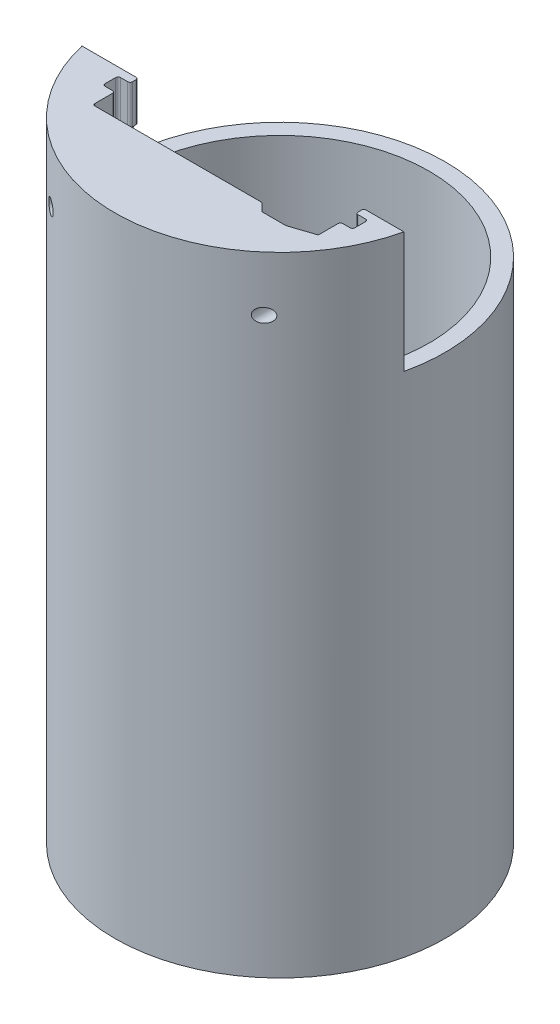
from build123d import *

# Parameters (mm, degrees)
SKETCH1_R                    = 20.5
SKETCH1_R_2                  = 7.5
BOSS_EXTRUDE1_DEPTH          = 3
SKETCH3_R                    = 1.4
CUT_EXTRUDE1_DEPTH           = 5
CHAMFER6_SIZE                = 0.3
CIRPATTERN2_COUNT            = 4
CHAMFER6_OF_CIRPATTERN2_SIZE = 0.3
SKETCH4_R                    = 20.5
SKETCH4_R_2                  = 1.4
SKETCH4_W                    = 1.5
SKETCH4_H                    = 1
BOSS_EXTRUDE2_DEPTH          = 60
SKETCH6_W                    = 1.5
SKETCH6_H                    = 1
BOSS_EXTRUDE4_DEPTH          = 15
FILLET1_R                    = 0.3
SKETCH7_R                    = 2.5
CUT_EXTRUDE2_DEPTH           = 1.5
SKETCH8_R                    = 0.85
CUT_EXTRUDE3_DEPTH           = 86.371248179
CHAMFER2_SIZE                = 0.2
CHAMFER4_SIZE                = 1
CHAMFER5_R                   = 0.2
SKETCH9_R                    = 1.4
CUT_EXTRUDE4_DEPTH           = 5


with BuildPart() as part:
    # Sketch1 → Boss-Extrude1 (new body)
    with BuildSketch(Plane(origin=(0, 0, 0), x_dir=(1, 0, 0), z_dir=(0, 1, 0))):
        with Locations(Location((0, 0, 0), (0, 0, 270))):
            Circle(SKETCH1_R)
        with Locations(Location((0, 0, 0), (0, 0, 270))):
            Circle(SKETCH1_R_2, mode=Mode.SUBTRACT)
    extrude(amount=BOSS_EXTRUDE1_DEPTH)

    # Sketch3 → Cut-Extrude1 (cut)
    with BuildSketch(Plane.XZ):
        with Locations(Location((0, 14.35, 0), (0, 0, 270))):
            Circle(SKETCH3_R)
    cut_extrude1 = extrude(amount=-CUT_EXTRUDE1_DEPTH, mode=Mode.SUBTRACT)

    # Chamfer6
    chamfer6_edges = [part.edges().sort_by_distance(p)[0] for p in [
        (0, 0, 15.75),
    ]]
    chamfer(chamfer6_edges, length=CHAMFER6_SIZE)

    # CirPattern2: Cut-Extrude1 ×4 about axis
    cirpattern2_axis = Axis((0, 0, 0), (0, 1, 0))
    for i in range(1, CIRPATTERN2_COUNT):
        add(cut_extrude1.rotate(cirpattern2_axis, i * 360 / CIRPATTERN2_COUNT), mode=Mode.SUBTRACT)

    # Chamfer6 of CirPattern2
    chamfer6_of_cirpattern2_edges = [part.edges().sort_by_distance(p)[0] for p in [
        (15.75, 0, 0),
        (0, 0, -15.75),
        (-15.75, 0, 0),
    ]]
    chamfer(chamfer6_of_cirpattern2_edges, length=CHAMFER6_OF_CIRPATTERN2_SIZE)

    # Sketch4 → Boss-Extrude2 (add)
    # profile 1 of 8: a face of its own
    with BuildSketch(Plane(origin=(0, 3, 0), x_dir=(1, 0, 0), z_dir=(0, 1, 0))):
        with Locations(Location((0, 0, 0), (0, 0, 270))):
            Circle(SKETCH4_R)
        with BuildLine():
            ThreePointArc((14.686303143, -11.25), (-3.697050438, -18.126825923), (-17.918984346, -4.6))
            ThreePointArc((-17.918984346, -4.6), (-2.318274099, 18.35417133), (18.5, 0))
            ThreePointArc((18.5, 0), (18.35417133, -2.318274099), (17.918984346, -4.6))
            ThreePointArc((17.918984346, -4.6), (16.751492877, -7.85095449), (15, -10.828203914))
            Line((15, -10.828203914), (15, -11.25))
            Line((15, -11.25), (14.686303143, -11.25))
        make_face(mode=Mode.SUBTRACT)
    # profile 2 of 8: a face of its own
    with BuildSketch(Plane(origin=(0, 3, 0), x_dir=(1, 0, 0), z_dir=(0, 1, 0))):
        with BuildLine():
            Line((-14.5, -7.5), (-14.5, -5.6))
            Line((-14.5, -5.6), (-14.5, -4.6))
            Line((-14.5, -4.6), (-17.918984346, -4.6))
            ThreePointArc((-17.918984346, -4.6), (-3.697050438, -18.126825923), (14.686303143, -11.25))
            Line((14.686303143, -11.25), (12, -11.25))
            Line((12, -11.25), (9, -11.25))
            Line((9, -11.25), (9, -10.25))
            Line((9, -10.25), (-13, -10.25))
            Line((-13, -10.25), (-13, -7.5))
            Line((-13, -7.5), (-14.5, -7.5))
        make_face()
        with Locations(Location((0, -14.35, 0), (0, 0, 270))):
            Circle(SKETCH4_R_2, mode=Mode.SUBTRACT)
    # profile 3 of 8: a face of its own
    with BuildSketch(Plane(origin=(0, 3, 0), x_dir=(1, 0, 0), z_dir=(0, 1, 0))):
        with BuildLine():
            Line((16.5, -4.6), (16.5, -5.6))
            Line((16.5, -5.6), (16.5, -7.5))
            Line((16.5, -7.5), (15, -7.5))
            Line((15, -7.5), (15, -10.25))
            Line((15, -10.25), (15, -10.828203914))
            ThreePointArc((15, -10.828203914), (16.751492877, -7.85095449), (17.918984346, -4.6))
            Line((17.918984346, -4.6), (16.5, -4.6))
        make_face()
    # profile 4 of 8: a face of its own
    with BuildSketch(Plane(origin=(0, 3, 0), x_dir=(1, 0, 0), z_dir=(0, 1, 0))):
        with BuildLine():
            Line((12, -11.25), (14.686303143, -11.25))
            ThreePointArc((14.686303143, -11.25), (14.844649762, -11.040216187), (15, -10.828203914))
            Line((15, -10.828203914), (15, -10.25))
            Line((15, -10.25), (12, -11.25))
        make_face()
    # profile 5 of 8: a face of its own
    with BuildSketch(Plane(origin=(0, 3, 0), x_dir=(1, 0, 0), z_dir=(0, 1, 0))):
        with Locations((15.75, -5.1)):
            Rectangle(SKETCH4_W, SKETCH4_H)
    # profile 6 of 8: a face of its own
    with BuildSketch(Plane(origin=(0, 3, 0), x_dir=(1, 0, 0), z_dir=(0, 1, 0))):
        with Locations((-13.75, -5.1)):
            Rectangle(SKETCH4_W, SKETCH4_H)
    # profile 7 of 8: a face of its own
    with BuildSketch(Plane(origin=(0, 3, 0), x_dir=(1, 0, 0), z_dir=(0, 1, 0))):
        with Locations(Location((0, -14.35, 0), (0, 0, 270))):
            Circle(SKETCH4_R_2)
    # profile 8 of 8: a face of its own
    with BuildSketch(Plane(origin=(0, 3, 0), x_dir=(1, 0, 0), z_dir=(0, 1, 0))):
        with BuildLine():
            ThreePointArc((15, -10.828203914), (14.844649762, -11.040216187), (14.686303143, -11.25))
            Line((14.686303143, -11.25), (15, -11.25))
            Line((15, -11.25), (15, -10.828203914))
        make_face()
    extrude(amount=BOSS_EXTRUDE2_DEPTH)

    # Sketch6 → Boss-Extrude4 (add)
    with BuildSketch(Plane(origin=(0, 63, 0), x_dir=(1, 0, 0), z_dir=(0, 1, 0))):
        with Locations((-13.75, -5.1)):
            Rectangle(SKETCH6_W, SKETCH6_H)
        with Locations((15.75, -5.1)):
            Rectangle(SKETCH6_W, SKETCH6_H)
        with BuildLine():
            Line((-14.5, -4.6), (-17.918984346, -4.6))
            ThreePointArc((-17.918984346, -4.6), (-3.697050438, -18.126825923), (14.686303143, -11.25))
            Line((14.686303143, -11.25), (12, -11.25))
            Line((12, -11.25), (9, -11.25))
            Line((9, -11.25), (9, -10.25))
            Line((9, -10.25), (-13, -10.25))
            Line((-13, -10.25), (-13, -7.5))
            Line((-13, -7.5), (-14.5, -7.5))
            Line((-14.5, -7.5), (-14.5, -5.6))
            Line((-14.5, -5.6), (-14.5, -4.6))
        make_face()
        with BuildLine():
            ThreePointArc((15, -10.828203914), (14.844649762, -11.040216187), (14.686303143, -11.25))
            Line((14.686303143, -11.25), (15, -11.25))
            Line((15, -11.25), (15, -10.828203914))
        make_face()
        with BuildLine():
            ThreePointArc((15, -10.828203914), (16.751492877, -7.85095449), (17.918984346, -4.6))
            Line((17.918984346, -4.6), (16.5, -4.6))
            Line((16.5, -4.6), (16.5, -5.6))
            Line((16.5, -5.6), (16.5, -7.5))
            Line((16.5, -7.5), (15, -7.5))
            Line((15, -7.5), (15, -10.25))
            Line((15, -10.25), (15, -10.828203914))
        make_face()
        with BuildLine():
            ThreePointArc((14.686303143, -11.25), (-3.697050438, -18.126825923), (-17.918984346, -4.6))
            Line((-17.918984346, -4.6), (-19.977237046, -4.6))
            ThreePointArc((-19.977237046, -4.6), (0, -20.5), (19.977237046, -4.6))
            Line((19.977237046, -4.6), (17.918984346, -4.6))
            ThreePointArc((17.918984346, -4.6), (16.751492877, -7.85095449), (15, -10.828203914))
            Line((15, -10.828203914), (15, -11.25))
            Line((15, -11.25), (14.686303143, -11.25))
        make_face()
        with BuildLine():
            Line((12, -11.25), (14.686303143, -11.25))
            ThreePointArc((14.686303143, -11.25), (14.844649762, -11.040216187), (15, -10.828203914))
            Line((15, -10.828203914), (15, -10.25))
            Line((15, -10.25), (12, -11.25))
        make_face()
    extrude(amount=BOSS_EXTRUDE4_DEPTH)

    # Fillet1
    fillet1_edges = [part.edges().sort_by_distance(p)[0] for p in [
        (15, 40.5, 4.6),
        (15, 40.5, 5.6),
        (16.5, 40.5, 5.6),
        (16.5, 40.5, 7.5),
        (15, 40.5, 7.5),
        (-13, 40.5, 10.25),
        (-13, 40.5, 7.5),
        (-14.5, 40.5, 7.5),
        (-14.5, 40.5, 5.6),
        (-13, 40.5, 5.6),
        (-13, 40.5, 4.6),
    ]]
    fillet(fillet1_edges, radius=FILLET1_R)

    # Sketch7 → Cut-Extrude2 (cut)
    with BuildSketch(Plane(origin=(0, 0, 4.6), x_dir=(-1, 0, 0), z_dir=(0, 0, -1))):
        with Locations((11.45, 71.2)):
            Circle(SKETCH7_R)
    cut_extrude2 = extrude(amount=-CUT_EXTRUDE2_DEPTH, mode=Mode.SUBTRACT)

    # Sketch8 → Cut-Extrude3 (cut, through all)
    with BuildSketch(Plane(origin=(0, 0, 7.5), x_dir=(-1, 0, 0), z_dir=(0, 0, -1))):
        with Locations((11.45, 71.2)):
            Circle(SKETCH8_R)
    cut_extrude3 = extrude(amount=-CUT_EXTRUDE3_DEPTH, mode=Mode.SUBTRACT)

    # Chamfer2
    chamfer2_edges = [part.edges().sort_by_distance(p)[0] for p in [
        (-10.6, 71.2, 10.25),
    ]]
    chamfer(chamfer2_edges, length=CHAMFER2_SIZE)

    # Mirror3: Cut-Extrude2, Cut-Extrude3 across plane
    add(cut_extrude2.mirror(Plane(origin=(1, 0, 0), x_dir=(0, 0, 1), z_dir=(1, 0, 0))), mode=Mode.SUBTRACT)
    add(cut_extrude3.mirror(Plane(origin=(1, 0, 0), x_dir=(0, 0, 1), z_dir=(1, 0, 0))), mode=Mode.SUBTRACT)

    # Chamfer4
    chamfer4_edges = [part.edges().sort_by_distance(p)[0] for p in [
        (9, 40.5, 10.25),
    ]]
    chamfer(chamfer4_edges, length=CHAMFER4_SIZE - 0.0001)  # a hair under: the kernel refuses the full size

    # Chamfer5
    chamfer5_edges = [part.edges().sort_by_distance(p)[0] for p in [
        (12.6, 71.199998189, 11.05),
    ]]
    fillet(chamfer5_edges, radius=CHAMFER5_R)

    # Sketch9 → Cut-Extrude4 (cut)
    with BuildSketch(Plane.XZ.offset(-3)):
        with Locations(Location((0, 14.35, 0), (0, 0, 270))):
            Circle(SKETCH9_R)
    extrude(amount=-CUT_EXTRUDE4_DEPTH, mode=Mode.SUBTRACT)


solid = part.part
